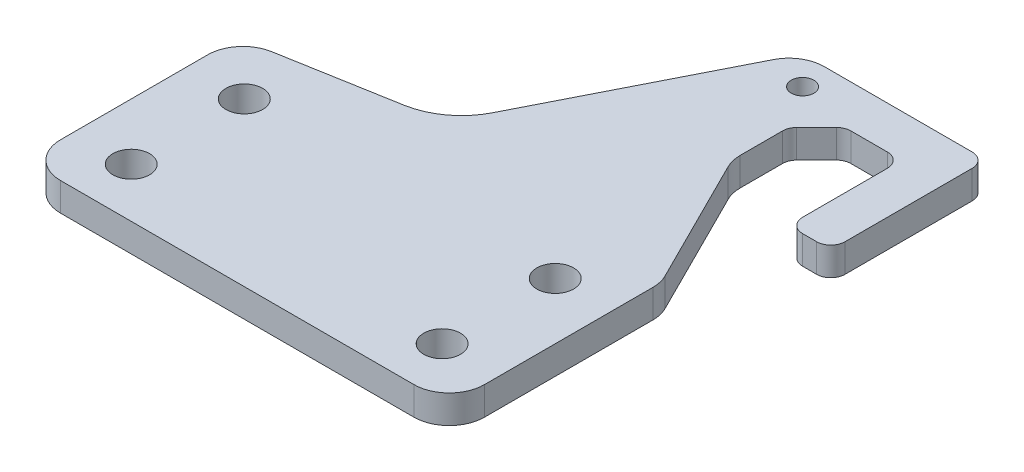
from build123d import *

# Parameters (mm, degrees)
EXTRUDE_1_DEPTH     = 4
FILLET_1_R          = 10
FILLET_2_R          = 5
SKETCH_2_R          = 2.6
CUT_EXTRUDE_1_DEPTH = 62.032778079
SKETCH_3_R          = 1.6
CUT_EXTRUDE_2_DEPTH = 62.032778079
EXTRUDE_2_DEPTH     = 4
FILLET_3_R          = 2


with BuildPart() as part:
    # 草图1 → 凸台-拉伸1 (new body)
    with BuildSketch(Plane(origin=(0, 0, 0), x_dir=(1, 0, 0), z_dir=(0, 1, 0))):
        Polygon((-30, -15), (30, -15), (30, 15), (20, 35), (20, 43), (24, 47), (24, 53), (12, 53), (-5, 19.408174518), (-30, 15), align=None)
    extrude(amount=EXTRUDE_1_DEPTH)

    # 圆角1
    fillet_1_edges = [part.edges().sort_by_distance(p)[0] for p in [
        (-5, 2, -19.408174518),
    ]]
    fillet(fillet_1_edges, radius=FILLET_1_R)

    # 圆角2
    fillet_2_edges = [part.edges().sort_by_distance(p)[0] for p in [
        (12, 2, -53),
        (20, 2, -35),
        (30, 2, -15),
        (30, 2, 15),
        (-30, 2, 15),
        (-30, 2, -15),
    ]]
    fillet(fillet_2_edges, radius=FILLET_2_R)

    # 草图2 → 切除-拉伸1 (cut, through all)
    with BuildSketch(Plane(origin=(0, 4, 0), x_dir=(1, 0, 0), z_dir=(0, 1, 0))):
        with Locations((-22, 8)):
            Circle(SKETCH_2_R)
        with Locations((22, 8)):
            Circle(SKETCH_2_R)
        with Locations((22, -8)):
            Circle(SKETCH_2_R)
        with Locations((-22, -8)):
            Circle(SKETCH_2_R)
    extrude(amount=-CUT_EXTRUDE_1_DEPTH, mode=Mode.SUBTRACT)

    # 草图3 → 切除-拉伸2 (cut, through all)
    with BuildSketch(Plane.XZ):
        with Locations((16, -49)):
            Circle(SKETCH_3_R)
    extrude(amount=-CUT_EXTRUDE_2_DEPTH, mode=Mode.SUBTRACT)

    # 草图4 → 凸台-拉伸2 (add)
    with BuildSketch(Plane(origin=(0, 4, 0), x_dir=(1, 0, 0), z_dir=(0, 1, 0))):
        Polygon((24, 47), (32, 47), (32, 31), (38, 31), (38, 53), (24, 53), align=None)
    extrude(amount=-EXTRUDE_2_DEPTH)

    # 圆角3
    fillet_3_edges = [part.edges().sort_by_distance(p)[0] for p in [
        (20, 2, -43),
        (24, 2, -47),
        (32, 2, -47),
        (32, 2, -31),
        (38, 2, -53),
        (38, 2, -31),
    ]]
    fillet(fillet_3_edges, radius=FILLET_3_R)


solid = part.part
